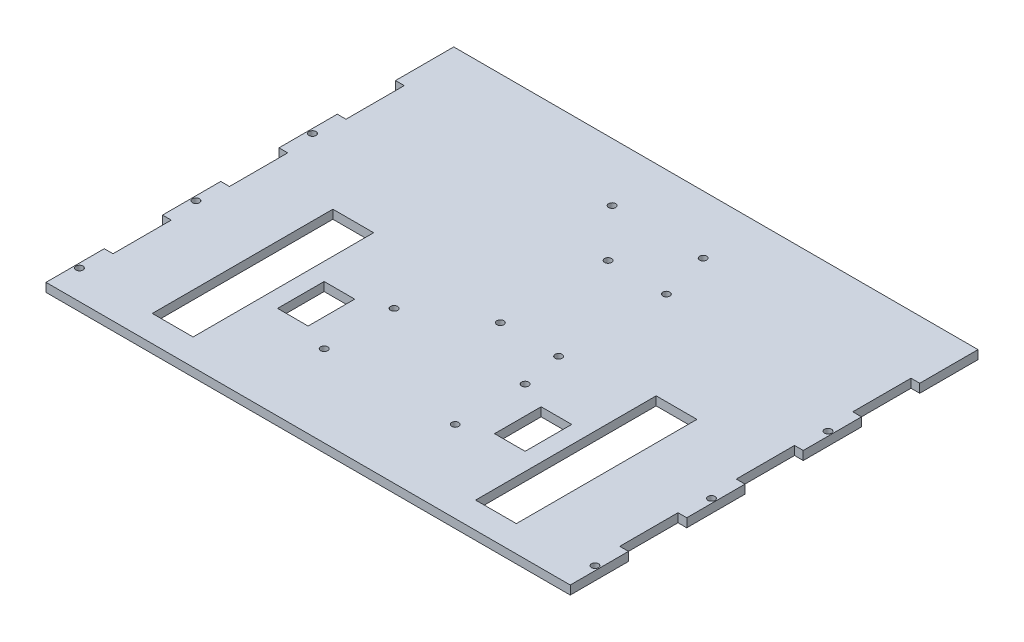
from build123d import *

# Parameters (mm, degrees)
SKETCH1_R           = 1.524
SKETCH1_W           = 13.335
SKETCH1_H           = 20.32
SKETCH1_W_2         = 17.78
SKETCH1_H_2         = 78.74
BOSS_EXTRUDE1_DEPTH = 3.81


with BuildPart() as part:
    # Sketch1 → Boss-Extrude1 (new body)
    with BuildSketch(Plane(origin=(0, 0, 0), x_dir=(1, 0, 0), z_dir=(0, 1, 0))):
        Polygon((-114.3, -88.9), (114.3, -88.9), (114.3, -63.5), (110.49, -63.5), (110.49, -38.1), (114.3, -38.1), (114.3, -12.7), (110.49, -12.7), (110.49, 12.7), (114.3, 12.7), (114.3, 38.1), (110.49, 38.1), (110.49, 63.5), (114.3, 63.5), (114.3, 88.9), (-114.3, 88.9), (-114.3, 63.5), (-110.49, 63.5), (-110.49, 38.1), (-114.3, 38.1), (-114.3, 12.7), (-110.49, 12.7), (-110.49, -12.7), (-114.3, -12.7), (-114.3, -38.1), (-110.49, -38.1), (-110.49, -63.5), (-114.3, -63.5), align=None)
        with Locations((-28.575, -22.86)):
            Circle(SKETCH1_R, mode=Mode.SUBTRACT)
        with Locations((-28.575, -53.34)):
            Circle(SKETCH1_R, mode=Mode.SUBTRACT)
        with Locations((28.575, -53.34)):
            Circle(SKETCH1_R, mode=Mode.SUBTRACT)
        with Locations((28.575, -22.86)):
            Circle(SKETCH1_R, mode=Mode.SUBTRACT)
        with Locations((0, 41.91)):
            Circle(SKETCH1_R, mode=Mode.SUBTRACT)
        with Locations((0, -5.08)):
            Circle(SKETCH1_R, mode=Mode.SUBTRACT)
        with Locations((25.4, -5.08)):
            Circle(SKETCH1_R, mode=Mode.SUBTRACT)
        with Locations((25.4, 41.91)):
            Circle(SKETCH1_R, mode=Mode.SUBTRACT)
        with Locations((112.395, -76.2)):
            Circle(SKETCH1_R, mode=Mode.SUBTRACT)
        with Locations((-112.395, -76.2)):
            Circle(SKETCH1_R, mode=Mode.SUBTRACT)
        with Locations((-112.395, -25.4)):
            Circle(SKETCH1_R, mode=Mode.SUBTRACT)
        with Locations((-112.395, 25.4)):
            Circle(SKETCH1_R, mode=Mode.SUBTRACT)
        with Locations((112.395, -25.4)):
            Circle(SKETCH1_R, mode=Mode.SUBTRACT)
        with Locations((112.395, 25.4)):
            Circle(SKETCH1_R, mode=Mode.SUBTRACT)
        with Locations((-19.8501, 63.5)):
            Circle(SKETCH1_R, mode=Mode.SUBTRACT)
        with Locations((19.8501, 63.5)):
            Circle(SKETCH1_R, mode=Mode.SUBTRACT)
        with Locations((-47.3075, -38.1)):
            Rectangle(SKETCH1_W, SKETCH1_H, mode=Mode.SUBTRACT)
        with Locations((70.485, -38.1)):
            Rectangle(SKETCH1_W_2, SKETCH1_H_2, mode=Mode.SUBTRACT)
        with Locations((-70.485, -38.1)):
            Rectangle(SKETCH1_W_2, SKETCH1_H_2, mode=Mode.SUBTRACT)
        with Locations((47.3075, -38.1)):
            Rectangle(SKETCH1_W, SKETCH1_H, mode=Mode.SUBTRACT)
    extrude(amount=BOSS_EXTRUDE1_DEPTH)


solid = part.part
